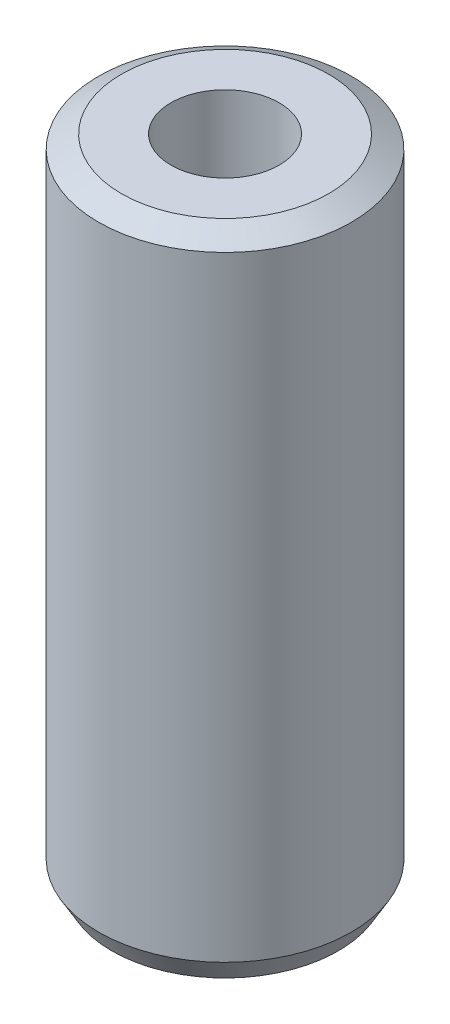
from build123d import *
from OCP.BRepFilletAPI import BRepFilletAPI_MakeChamfer

# Parameters (mm, degrees)
SKETCH1_R           = 45
BOSS_EXTRUDE1_DEPTH = 231.583665846
SKETCH2_R           = 19.253142685
CUT_EXTRUDE1_DEPTH  = 241.168678821
CHAMFER1_SIZE       = 4.705277013
CHAMFER1_SIZE2      = 8.14977885


with BuildPart() as part:
    # Sketch1 → Boss-Extrude1 (new body)
    with BuildSketch(Plane(origin=(0, 0, 0), x_dir=(1, 0, 0), z_dir=(0, 1, 0))):
        Circle(SKETCH1_R)
    extrude(amount=BOSS_EXTRUDE1_DEPTH)

    # Sketch2 → Cut-Extrude1 (cut, through all)
    with BuildSketch(Plane(origin=(0, 0, 0), x_dir=(1, 0, 0), z_dir=(0, 1, 0))):
        Circle(SKETCH2_R)
    extrude(amount=CUT_EXTRUDE1_DEPTH, mode=Mode.SUBTRACT)

    # Chamfer1: one chamfer whose edges measure the first distance from different faces: ONE call of the kernel's chamfer builder (chamfer() names one face for all edges)
    chamfer1_edges_1 = [part.edges().sort_by_distance(p)[0] for p in [
        (-45, 231.583665846, 0),
    ]]
    chamfer1_side_1 = [part.faces().sort_by_distance(p)[0] for p in [
        (-45, 115.791832923, 0),
    ]]
    chamfer1_edges_2 = [part.edges().sort_by_distance(p)[0] for p in [
        (-45, 0, 0),
    ]]
    chamfer1_side_2 = [part.faces().sort_by_distance(p)[0] for p in [
        (-43.727207794, 0, 0),
    ]]
    chamfer1 = BRepFilletAPI_MakeChamfer(part.part.solid().wrapped)
    for e in chamfer1_edges_1:
        chamfer1.Add(CHAMFER1_SIZE, CHAMFER1_SIZE2, e.wrapped, chamfer1_side_1[0].wrapped)  # the first distance lies on this face
    for e in chamfer1_edges_2:
        chamfer1.Add(CHAMFER1_SIZE, CHAMFER1_SIZE2, e.wrapped, chamfer1_side_2[0].wrapped)  # the first distance lies on this face
    add(Compound.cast(chamfer1.Shape()), mode=Mode.REPLACE)


solid = part.part
